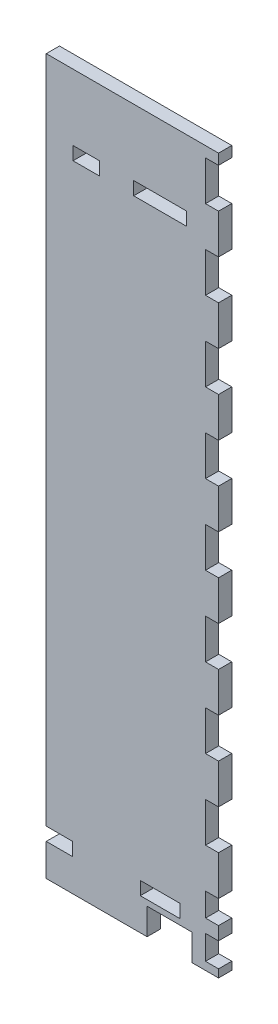
from build123d import *

# Parameters (mm, degrees)
ESQUISSE1_W             = 65.121094869
ESQUISSE1_H             = 270
BOSS_EXTRU_1_DEPTH      = 5
ESQUISSE2_W             = 10
ESQUISSE2_H             = 5
ESQUISSE2_W_2           = 15
ESQUISSE2_W_3           = 4.92
ESQUISSE2_H_2           = 9.15
ESQUISSE2_H_3           = 8.85
ESQUISSE2_H_4           = 15
ESQUISSE2_W_4           = 20
ENL_V_MAT_EXTRU_1_DEPTH = 5
ESQUISSE3_W             = 17
ESQUISSE3_H             = 10
ENL_V_MAT_EXTRU_2_DEPTH = 5


with BuildPart() as part:
    # Esquisse1 → Boss.-Extru.1 (new body)
    with BuildSketch(Plane.XY):
        with Locations((32.560547435, 135)):
            Rectangle(ESQUISSE1_W, ESQUISSE1_H)
    extrude(amount=-BOSS_EXTRU_1_DEPTH)

    # Esquisse2 → Enlèv. mat.-Extru.1 (cut)
    with BuildSketch(Plane.XY):
        with Locations((5, 14.65)):
            Rectangle(ESQUISSE2_W, ESQUISSE2_H)
        with Locations((43.049292824, 14.65)):
            Rectangle(ESQUISSE2_W_2, ESQUISSE2_H)
        with Locations((62.661094869, 7.575)):
            Rectangle(ESQUISSE2_W_3, ESQUISSE2_H_2)
        with Locations((62.661094869, 21.575)):
            Rectangle(ESQUISSE2_W_3, ESQUISSE2_H_3)
        with Locations((62.661094869, 258.5)):
            Rectangle(ESQUISSE2_W_3, ESQUISSE2_H_4)
        with Locations((62.661094869, 228.5)):
            Rectangle(ESQUISSE2_W_3, ESQUISSE2_H_4)
        with Locations((62.661094869, 198.5)):
            Rectangle(ESQUISSE2_W_3, ESQUISSE2_H_4)
        with Locations((62.661094869, 168.5)):
            Rectangle(ESQUISSE2_W_3, ESQUISSE2_H_4)
        with Locations((62.661094869, 138.5)):
            Rectangle(ESQUISSE2_W_3, ESQUISSE2_H_4)
        with Locations((62.661094869, 108.5)):
            Rectangle(ESQUISSE2_W_3, ESQUISSE2_H_4)
        with Locations((62.661094869, 78.5)):
            Rectangle(ESQUISSE2_W_3, ESQUISSE2_H_4)
        with Locations((62.661094869, 48.5)):
            Rectangle(ESQUISSE2_W_3, ESQUISSE2_H_4)
        with Locations((15.121094869, 242.5)):
            Rectangle(ESQUISSE2_W, ESQUISSE2_H)
        with Locations((43.049292824, 242.5)):
            Rectangle(ESQUISSE2_W_4, ESQUISSE2_H)
    extrude(amount=-ENL_V_MAT_EXTRU_1_DEPTH, mode=Mode.SUBTRACT)

    # Esquisse3 → Enlèv. mat.-Extru.2 (cut)
    with BuildSketch(Plane.XY):
        with Locations((46.621094869, 5)):
            Rectangle(ESQUISSE3_W, ESQUISSE3_H)
    extrude(amount=-ENL_V_MAT_EXTRU_2_DEPTH, mode=Mode.SUBTRACT)


solid = part.part
